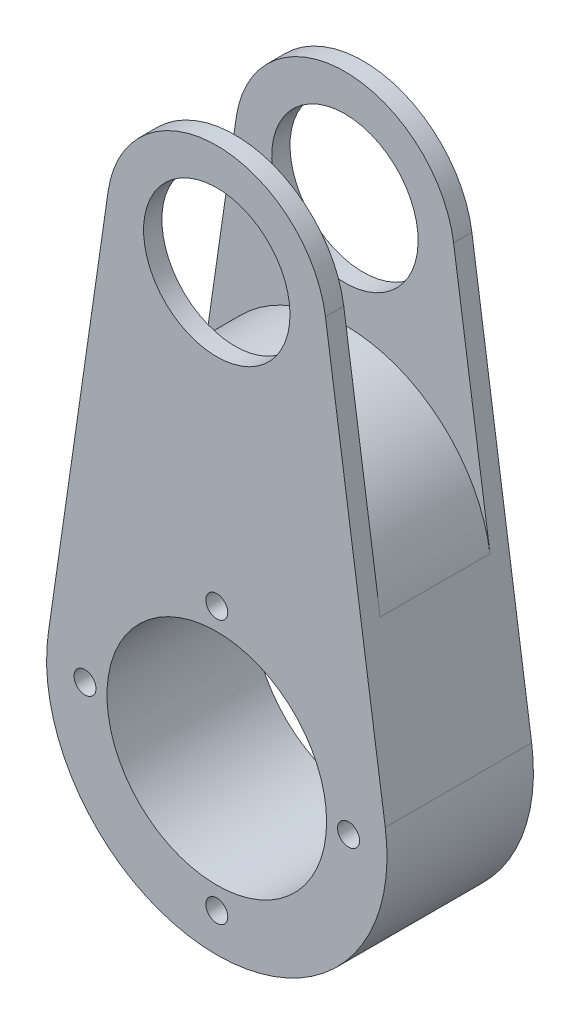
from build123d import *

# Parameters (mm, degrees)
CROQUIS1_R                 = 15
CROQUIS1_R_2               = 1.5
CROQUIS1_R_3               = 10
SALIENTE_EXTRUIR1_DEPTH    = 10
CORTAR_EXTRUIR2_DEPTH      = 78.41605161
CORTAR_EXTRUIR2_DEPTH_BACK = 78.41605161
REDONDEO3_R                = 20


with BuildPart() as part:
    # Croquis1 → Saliente-Extruir1 (new, symmetric)
    with BuildSketch(Plane.XY):
        with BuildLine():
            Line((-23.009443154, 3.997898972), (-14.844802035, 60.31420332))
            ThreePointArc((-14.844802035, 60.31420332), (0, 73.162029407), (14.844802035, 60.31420332))
            Line((14.844802035, 60.31420332), (23.009443154, 3.997898972))
            ThreePointArc((23.009443154, 3.997898972), (0, -22.587970593), (-23.009443154, 3.997898972))
        make_face()
        with Locations((0, 0.662029407)):
            Circle(CROQUIS1_R, mode=Mode.SUBTRACT)
        with Locations((0, 18.662029407)):
            Circle(CROQUIS1_R_2, mode=Mode.SUBTRACT)
        with Locations((18, 0.662029407)):
            Circle(CROQUIS1_R_2, mode=Mode.SUBTRACT)
        with Locations((0, -17.337970593)):
            Circle(CROQUIS1_R_2, mode=Mode.SUBTRACT)
        with Locations((-18, 0.662029407)):
            Circle(CROQUIS1_R_2, mode=Mode.SUBTRACT)
        with Locations((0, 58.162029407)):
            Circle(CROQUIS1_R_3, mode=Mode.SUBTRACT)
    extrude(amount=SALIENTE_EXTRUIR1_DEPTH, both=True)

    # Croquis3 → Cortar-Extruir2 (cut, two sides: drawn at the far end of the back side and taken through both)
    with BuildSketch(Plane(origin=(0, 0, 0), x_dir=(0, 0, -1), z_dir=(1, 0, 0)).offset(-CORTAR_EXTRUIR2_DEPTH_BACK)):
        Polygon((0, 73.162029407), (7.5, 73.162029407), (7.5, 43.162029407), (-7.5, 43.162029407), (-7.5, 73.162029407), align=None)
    extrude(amount=CORTAR_EXTRUIR2_DEPTH + CORTAR_EXTRUIR2_DEPTH_BACK, mode=Mode.SUBTRACT)

    # Redondeo3
    redondeo3_edges = [part.edges().sort_by_distance(p)[0] for p in [
        (17.331494761, 43.162029407, 0),
        (-17.331494761, 43.162029407, 0),
    ]]
    fillet(redondeo3_edges, radius=REDONDEO3_R)


solid = part.part
